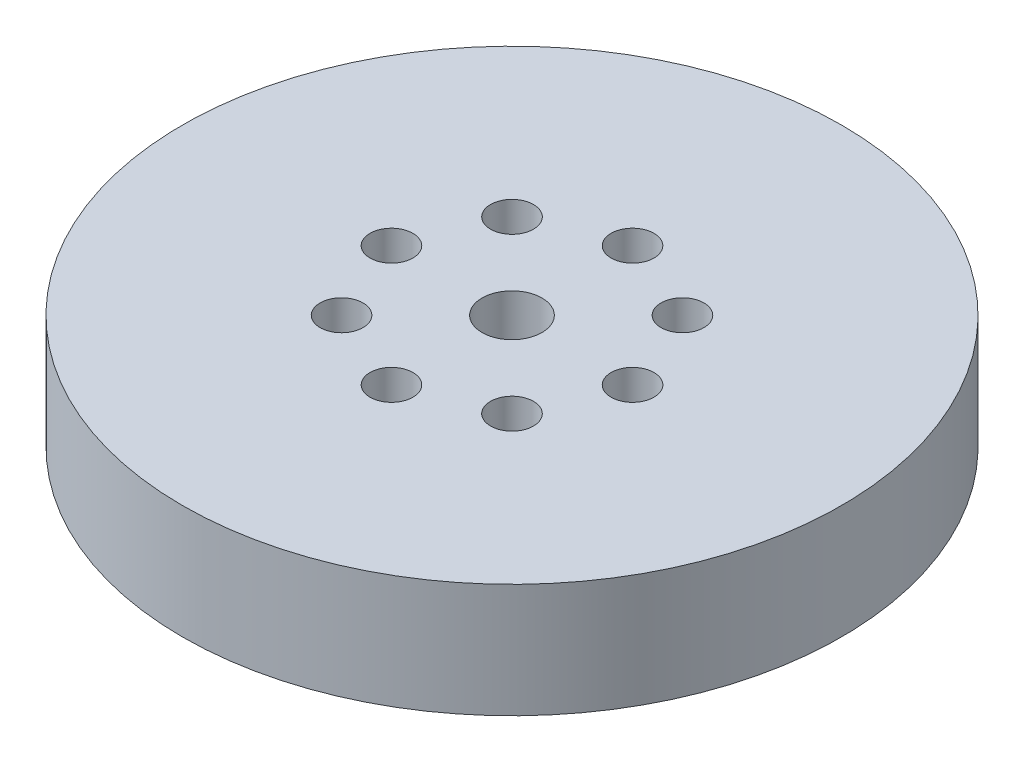
from build123d import *

# Parameters (mm, degrees)
SKETCH1_R           = 55
BOSS_EXTRUDE1_DEPTH = 19
SKETCH2_R           = 5
CUT_EXTRUDE1_DEPTH  = 81.068720484
SKETCH3_R           = 3.578206539
CUT_EXTRUDE2_DEPTH  = 18.259386029
CIRPATTERN1_COUNT   = 8


with BuildPart() as part:
    # Sketch1 → Boss-Extrude1 (new body)
    with BuildSketch(Plane(origin=(0, 0, 0), x_dir=(1, 0, 0), z_dir=(0, 1, 0))):
        Circle(SKETCH1_R)
    extrude(amount=BOSS_EXTRUDE1_DEPTH)

    # Sketch2 → Cut-Extrude1 (cut, through all)
    with BuildSketch(Plane(origin=(0, 0, 0), x_dir=(1, 0, 0), z_dir=(0, 1, 0))):
        Circle(SKETCH2_R)
    extrude(amount=CUT_EXTRUDE1_DEPTH, mode=Mode.SUBTRACT)

    # Sketch3 → Cut-Extrude2 (cut)
    with BuildSketch(Plane(origin=(0, 19, 0), x_dir=(1, 0, 0), z_dir=(0, 1, 0))):
        with Locations((-20.116316415, 0)):
            Circle(SKETCH3_R)
    cut_extrude2 = extrude(amount=-CUT_EXTRUDE2_DEPTH, mode=Mode.SUBTRACT)

    # CirPattern1: Cut-Extrude2 ×8 about axis
    cirpattern1_axis = Axis((0, 0, 0), (0, 1, 0))
    for i in range(1, CIRPATTERN1_COUNT):
        add(cut_extrude2.rotate(cirpattern1_axis, i * 360 / CIRPATTERN1_COUNT), mode=Mode.SUBTRACT)


solid = part.part
